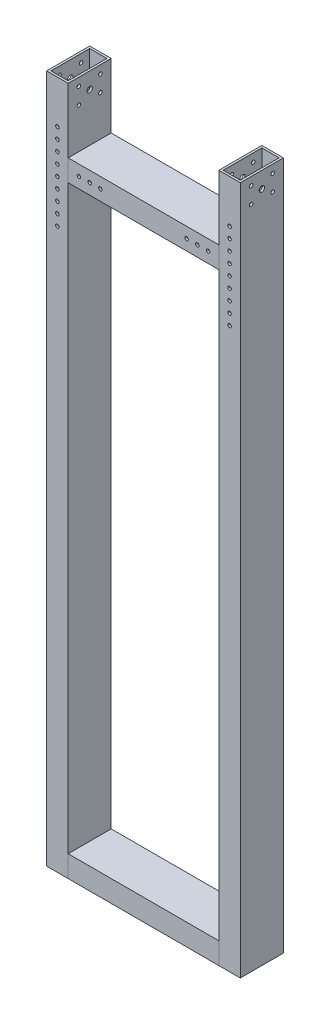
from build123d import *

# Parameters (mm, degrees)
VERSAFRAME_START                             = -114.3
VERSAFRAME_VERSAFRAME_2_X_1_X_0_1_1_OUT_W    = 812.8
VERSAFRAME_VERSAFRAME_2_X_1_X_0_1_1_OUT_H    = 50.8
VERSAFRAME_VERSAFRAME_2_X_1_X_0_1_1_DEPTH    = 2.54
VERSAFRAME_START_2                           = -91.44
VERSAFRAME_VERSAFRAME_2_X_1_X_0_1_1_2_O_W    = 812.8
VERSAFRAME_VERSAFRAME_2_X_1_X_0_1_1_2_O_H    = 50.8
VERSAFRAME_VERSAFRAME_2_X_1_X_0_1_1_2_DEPTH  = 2.54
VERSAFRAME_START_3                           = -111.76
VERSAFRAME_VERSAFRAME_2_X_1_X_0_1_1_3_O_W    = 812.8
VERSAFRAME_VERSAFRAME_2_X_1_X_0_1_1_3_O_H    = 2.54
VERSAFRAME_VERSAFRAME_2_X_1_X_0_1_1_3_DEPTH  = 20.32
VERSAFRAME_START_4                           = -406.4
VERSAFRAME_VERSAFRAME_2_X_1_X_0_1_1_4_O_W    = 177.8
VERSAFRAME_VERSAFRAME_2_X_1_X_0_1_1_4_O_H    = 50.8
VERSAFRAME_VERSAFRAME_2_X_1_X_0_1_1_4_DEPTH  = 2.54
VERSAFRAME_START_5                           = -383.54
VERSAFRAME_VERSAFRAME_2_X_1_X_0_1_1_5_O_W    = 177.8
VERSAFRAME_VERSAFRAME_2_X_1_X_0_1_1_5_O_H    = 50.8
VERSAFRAME_VERSAFRAME_2_X_1_X_0_1_1_5_DEPTH  = 2.54
VERSAFRAME_START_6                           = -403.86
VERSAFRAME_VERSAFRAME_2_X_1_X_0_1_1_6_O_W    = 177.8
VERSAFRAME_VERSAFRAME_2_X_1_X_0_1_1_6_O_H    = 2.54
VERSAFRAME_VERSAFRAME_2_X_1_X_0_1_1_6_DEPTH  = 20.32
VERSAFRAME_START_7                           = 88.9
VERSAFRAME_VERSAFRAME_2_X_1_X_0_1_1_7_O_W    = 812.8
VERSAFRAME_VERSAFRAME_2_X_1_X_0_1_1_7_O_H    = 50.8
VERSAFRAME_VERSAFRAME_2_X_1_X_0_1_1_7_DEPTH  = 2.54
VERSAFRAME_START_8                           = 111.76
VERSAFRAME_VERSAFRAME_2_X_1_X_0_1_1_8_O_W    = 812.8
VERSAFRAME_VERSAFRAME_2_X_1_X_0_1_1_8_O_H    = 50.8
VERSAFRAME_VERSAFRAME_2_X_1_X_0_1_1_8_DEPTH  = 2.54
VERSAFRAME_START_9                           = 91.44
VERSAFRAME_VERSAFRAME_2_X_1_X_0_1_1_9_O_W    = 812.8
VERSAFRAME_VERSAFRAME_2_X_1_X_0_1_1_9_O_H    = 2.54
VERSAFRAME_VERSAFRAME_2_X_1_X_0_1_1_9_DEPTH  = 20.32
VERSAFRAME_START_10                          = 304.8
VERSAFRAME_VERSAFRAME_2_X_1_X_0_1_1_11_W     = 177.8
VERSAFRAME_VERSAFRAME_2_X_1_X_0_1_1_11_H     = 50.8
VERSAFRAME_VERSAFRAME_2_X_1_X_0_1_1_10_DEPTH = 2.54
VERSAFRAME_START_11                          = 327.66
VERSAFRAME_VERSAFRAME_2_X_1_X_0_1_1_13_W     = 177.8
VERSAFRAME_VERSAFRAME_2_X_1_X_0_1_1_13_H     = 50.8
VERSAFRAME_VERSAFRAME_2_X_1_X_0_1_1_12_DEPTH = 2.54
VERSAFRAME_START_12                          = 307.34
VERSAFRAME_VERSAFRAME_2_X_1_X_0_1_1_15_W     = 177.8
VERSAFRAME_VERSAFRAME_2_X_1_X_0_1_1_15_H     = 2.54
VERSAFRAME_VERSAFRAME_2_X_1_X_0_1_1_14_DEPTH = 20.32
SKETCH2_R                                    = 2.07
SKETCH2_R_2                                  = 3.175
CUT_EXTRUDE1_DEPTH                           = 228.6
CUT_EXTRUDE2_DEPTH                           = 426.212993687
CUT_EXTRUDE2_DEPTH_BACK                      = 426.212993687
SKETCH4_R                                    = 2.075


# Read off the part's stored shape, not the designer's step: Versaframe VERSAFRAME 2 X 1 X 0.1 (1)
with BuildPart() as part:
    # Versaframe VERSAFRAME 2 X 1 X 0.1 (1) out → Versaframe VERSAFRAME 2 X 1 X 0.1 (1) (new body)
    with BuildSketch(Plane.YZ.offset(VERSAFRAME_START)):
        Rectangle(VERSAFRAME_VERSAFRAME_2_X_1_X_0_1_1_OUT_W, VERSAFRAME_VERSAFRAME_2_X_1_X_0_1_1_OUT_H)
    extrude(amount=VERSAFRAME_VERSAFRAME_2_X_1_X_0_1_1_DEPTH)

    # Versaframe VERSAFRAME 2 X 1 X 0.1 _1 2 o → Versaframe VERSAFRAME 2 X 1 X 0.1 _1 2 (add)
    with BuildSketch(Plane.YZ.offset(VERSAFRAME_START_2)):
        Rectangle(VERSAFRAME_VERSAFRAME_2_X_1_X_0_1_1_2_O_W, VERSAFRAME_VERSAFRAME_2_X_1_X_0_1_1_2_O_H)
    extrude(amount=VERSAFRAME_VERSAFRAME_2_X_1_X_0_1_1_2_DEPTH)

    # Versaframe VERSAFRAME 2 X 1 X 0.1 _1 3 o → Versaframe VERSAFRAME 2 X 1 X 0.1 _1 3 (add)
    with BuildSketch(Plane.YZ.offset(VERSAFRAME_START_3)):
        with Locations((0, 24.13)):
            Rectangle(VERSAFRAME_VERSAFRAME_2_X_1_X_0_1_1_3_O_W, VERSAFRAME_VERSAFRAME_2_X_1_X_0_1_1_3_O_H)
        with Locations((0, -24.13)):
            Rectangle(VERSAFRAME_VERSAFRAME_2_X_1_X_0_1_1_3_O_W, VERSAFRAME_VERSAFRAME_2_X_1_X_0_1_1_3_O_H)
    extrude(amount=VERSAFRAME_VERSAFRAME_2_X_1_X_0_1_1_3_DEPTH)


with BuildPart() as body_2:
    # Versaframe VERSAFRAME 2 X 1 X 0.1 _1 4 o → Versaframe VERSAFRAME 2 X 1 X 0.1 _1 4 (new body)
    with BuildSketch(Plane(origin=(0, 0, 0), x_dir=(1, 0, 0), z_dir=(0, 1, 0)).offset(VERSAFRAME_START_4)):
        Rectangle(VERSAFRAME_VERSAFRAME_2_X_1_X_0_1_1_4_O_W, VERSAFRAME_VERSAFRAME_2_X_1_X_0_1_1_4_O_H)
    extrude(amount=VERSAFRAME_VERSAFRAME_2_X_1_X_0_1_1_4_DEPTH)

    # Versaframe VERSAFRAME 2 X 1 X 0.1 _1 5 o → Versaframe VERSAFRAME 2 X 1 X 0.1 _1 5 (add)
    with BuildSketch(Plane(origin=(0, 0, 0), x_dir=(1, 0, 0), z_dir=(0, 1, 0)).offset(VERSAFRAME_START_5)):
        Rectangle(VERSAFRAME_VERSAFRAME_2_X_1_X_0_1_1_5_O_W, VERSAFRAME_VERSAFRAME_2_X_1_X_0_1_1_5_O_H)
    extrude(amount=VERSAFRAME_VERSAFRAME_2_X_1_X_0_1_1_5_DEPTH)

    # Versaframe VERSAFRAME 2 X 1 X 0.1 _1 6 o → Versaframe VERSAFRAME 2 X 1 X 0.1 _1 6 (add)
    with BuildSketch(Plane(origin=(0, 0, 0), x_dir=(1, 0, 0), z_dir=(0, 1, 0)).offset(VERSAFRAME_START_6)):
        with Locations((0, 24.13)):
            Rectangle(VERSAFRAME_VERSAFRAME_2_X_1_X_0_1_1_6_O_W, VERSAFRAME_VERSAFRAME_2_X_1_X_0_1_1_6_O_H)
        with Locations((0, -24.13)):
            Rectangle(VERSAFRAME_VERSAFRAME_2_X_1_X_0_1_1_6_O_W, VERSAFRAME_VERSAFRAME_2_X_1_X_0_1_1_6_O_H)
    extrude(amount=VERSAFRAME_VERSAFRAME_2_X_1_X_0_1_1_6_DEPTH)


with BuildPart() as body_3:
    # Versaframe VERSAFRAME 2 X 1 X 0.1 _1 7 o → Versaframe VERSAFRAME 2 X 1 X 0.1 _1 7 (new body)
    with BuildSketch(Plane.YZ.offset(VERSAFRAME_START_7)):
        Rectangle(VERSAFRAME_VERSAFRAME_2_X_1_X_0_1_1_7_O_W, VERSAFRAME_VERSAFRAME_2_X_1_X_0_1_1_7_O_H)
    extrude(amount=VERSAFRAME_VERSAFRAME_2_X_1_X_0_1_1_7_DEPTH)

    # Versaframe VERSAFRAME 2 X 1 X 0.1 _1 8 o → Versaframe VERSAFRAME 2 X 1 X 0.1 _1 8 (add)
    with BuildSketch(Plane.YZ.offset(VERSAFRAME_START_8)):
        Rectangle(VERSAFRAME_VERSAFRAME_2_X_1_X_0_1_1_8_O_W, VERSAFRAME_VERSAFRAME_2_X_1_X_0_1_1_8_O_H)
    extrude(amount=VERSAFRAME_VERSAFRAME_2_X_1_X_0_1_1_8_DEPTH)

    # Versaframe VERSAFRAME 2 X 1 X 0.1 _1 9 o → Versaframe VERSAFRAME 2 X 1 X 0.1 _1 9 (add)
    with BuildSketch(Plane.YZ.offset(VERSAFRAME_START_9)):
        with Locations((0, 24.13)):
            Rectangle(VERSAFRAME_VERSAFRAME_2_X_1_X_0_1_1_9_O_W, VERSAFRAME_VERSAFRAME_2_X_1_X_0_1_1_9_O_H)
        with Locations((0, -24.13)):
            Rectangle(VERSAFRAME_VERSAFRAME_2_X_1_X_0_1_1_9_O_W, VERSAFRAME_VERSAFRAME_2_X_1_X_0_1_1_9_O_H)
    extrude(amount=VERSAFRAME_VERSAFRAME_2_X_1_X_0_1_1_9_DEPTH)


with BuildPart() as body_4:
    # Versaframe VERSAFRAME 2 X 1 X 0.1 _1 11 → Versaframe VERSAFRAME 2 X 1 X 0.1 _1 10 (new body)
    with BuildSketch(Plane(origin=(0, 0, 0), x_dir=(1, 0, 0), z_dir=(0, 1, 0)).offset(VERSAFRAME_START_10)):
        Rectangle(VERSAFRAME_VERSAFRAME_2_X_1_X_0_1_1_11_W, VERSAFRAME_VERSAFRAME_2_X_1_X_0_1_1_11_H)
    extrude(amount=VERSAFRAME_VERSAFRAME_2_X_1_X_0_1_1_10_DEPTH)

    # Versaframe VERSAFRAME 2 X 1 X 0.1 _1 13 → Versaframe VERSAFRAME 2 X 1 X 0.1 _1 12 (add)
    with BuildSketch(Plane(origin=(0, 0, 0), x_dir=(1, 0, 0), z_dir=(0, 1, 0)).offset(VERSAFRAME_START_11)):
        Rectangle(VERSAFRAME_VERSAFRAME_2_X_1_X_0_1_1_13_W, VERSAFRAME_VERSAFRAME_2_X_1_X_0_1_1_13_H)
    extrude(amount=VERSAFRAME_VERSAFRAME_2_X_1_X_0_1_1_12_DEPTH)

    # Versaframe VERSAFRAME 2 X 1 X 0.1 _1 15 → Versaframe VERSAFRAME 2 X 1 X 0.1 _1 14 (add)
    with BuildSketch(Plane(origin=(0, 0, 0), x_dir=(1, 0, 0), z_dir=(0, 1, 0)).offset(VERSAFRAME_START_12)):
        with Locations((0, 24.13)):
            Rectangle(VERSAFRAME_VERSAFRAME_2_X_1_X_0_1_1_15_W, VERSAFRAME_VERSAFRAME_2_X_1_X_0_1_1_15_H)
        with Locations((0, -24.13)):
            Rectangle(VERSAFRAME_VERSAFRAME_2_X_1_X_0_1_1_15_W, VERSAFRAME_VERSAFRAME_2_X_1_X_0_1_1_15_H)
    extrude(amount=VERSAFRAME_VERSAFRAME_2_X_1_X_0_1_1_14_DEPTH)


with BuildPart() as cut_extrude1_tool:
    # Sketch2 → Cut-Extrude1 (new body)
    with BuildSketch(Plane(origin=(114.3, 0, 0), x_dir=(0, 0, -1), z_dir=(1, 0, 0))):
        with Locations((-12.7, 396.875)):
            Circle(SKETCH2_R)
        with Locations((-12.7, 377.825)):
            Circle(SKETCH2_R)
        with Locations((12.7, 396.875)):
            Circle(SKETCH2_R)
        with Locations((0, 387.35)):
            Circle(SKETCH2_R_2)
        with Locations((12.7, 377.825)):
            Circle(SKETCH2_R)
    extrude(amount=-CUT_EXTRUDE1_DEPTH)


with BuildPart() as part_1:
    add(part.part)

    # Cut-Extrude1: cut by cut_extrude1_tool
    add(cut_extrude1_tool.part, mode=Mode.SUBTRACT)


with BuildPart() as body_3_1:
    add(body_3.part)

    # Cut-Extrude1: cut by cut_extrude1_tool
    add(cut_extrude1_tool.part, mode=Mode.SUBTRACT)


with BuildPart() as cut_extrude2_tool:
    # Sketch4 → Cut-Extrude2 (new, two sides: drawn at the far end of the back side and taken through both)
    with BuildSketch(Plane.XY.offset(25.4).offset(-CUT_EXTRUDE2_DEPTH_BACK)):
        with Locations((-101.6, 355.6)):
            Circle(SKETCH4_R)
        with Locations((-101.6, 342.9)):
            Circle(SKETCH4_R)
        with Locations((-101.6, 330.2)):
            Circle(SKETCH4_R)
        with Locations((-101.6, 317.5)):
            Circle(SKETCH4_R)
        with Locations((-101.6, 304.8)):
            Circle(SKETCH4_R)
        with Locations((-101.6, 292.1)):
            Circle(SKETCH4_R)
        with Locations((-101.6, 279.4)):
            Circle(SKETCH4_R)
        with Locations((-101.6, 266.7)):
            Circle(SKETCH4_R)
        with Locations((-101.6, 254)):
            Circle(SKETCH4_R)
        with Locations(Location((-76.2, 317.5, 0), (0, 0, 90))):
            Circle(SKETCH4_R)
        with Locations(Location((-63.5, 317.5, 0), (0, 0, 90))):
            Circle(SKETCH4_R)
        with Locations(Location((-50.8, 317.5, 0), (0, 0, 90))):
            Circle(SKETCH4_R)
        with Locations((101.6, 254)):
            Circle(SKETCH4_R)
        with Locations((101.6, 266.7)):
            Circle(SKETCH4_R)
        with Locations((101.6, 279.4)):
            Circle(SKETCH4_R)
        with Locations((101.6, 292.1)):
            Circle(SKETCH4_R)
        with Locations((101.6, 304.8)):
            Circle(SKETCH4_R)
        with Locations((101.6, 317.5)):
            Circle(SKETCH4_R)
        with Locations((101.6, 330.2)):
            Circle(SKETCH4_R)
        with Locations((101.6, 342.9)):
            Circle(SKETCH4_R)
        with Locations(Location((50.8, 317.5, 0), (0, 0, 90))):
            Circle(SKETCH4_R)
        with Locations(Location((63.5, 317.5, 0), (0, 0, 90))):
            Circle(SKETCH4_R)
        with Locations(Location((76.2, 317.5, 0), (0, 0, 90))):
            Circle(SKETCH4_R)
        with Locations((101.6, 355.6)):
            Circle(SKETCH4_R)
    extrude(amount=CUT_EXTRUDE2_DEPTH + CUT_EXTRUDE2_DEPTH_BACK)


with BuildPart() as part_2:
    add(part_1.part)

    # Cut-Extrude2: cut by cut_extrude2_tool
    add(cut_extrude2_tool.part, mode=Mode.SUBTRACT)


with BuildPart() as body_3_2:
    add(body_3_1.part)

    # Cut-Extrude2: cut by cut_extrude2_tool
    add(cut_extrude2_tool.part, mode=Mode.SUBTRACT)


with BuildPart() as body_4_1:
    add(body_4.part)

    # Cut-Extrude2: cut by cut_extrude2_tool
    add(cut_extrude2_tool.part, mode=Mode.SUBTRACT)


solid = Compound([body_2.part, part_2.part, body_3_2.part, body_4_1.part])
